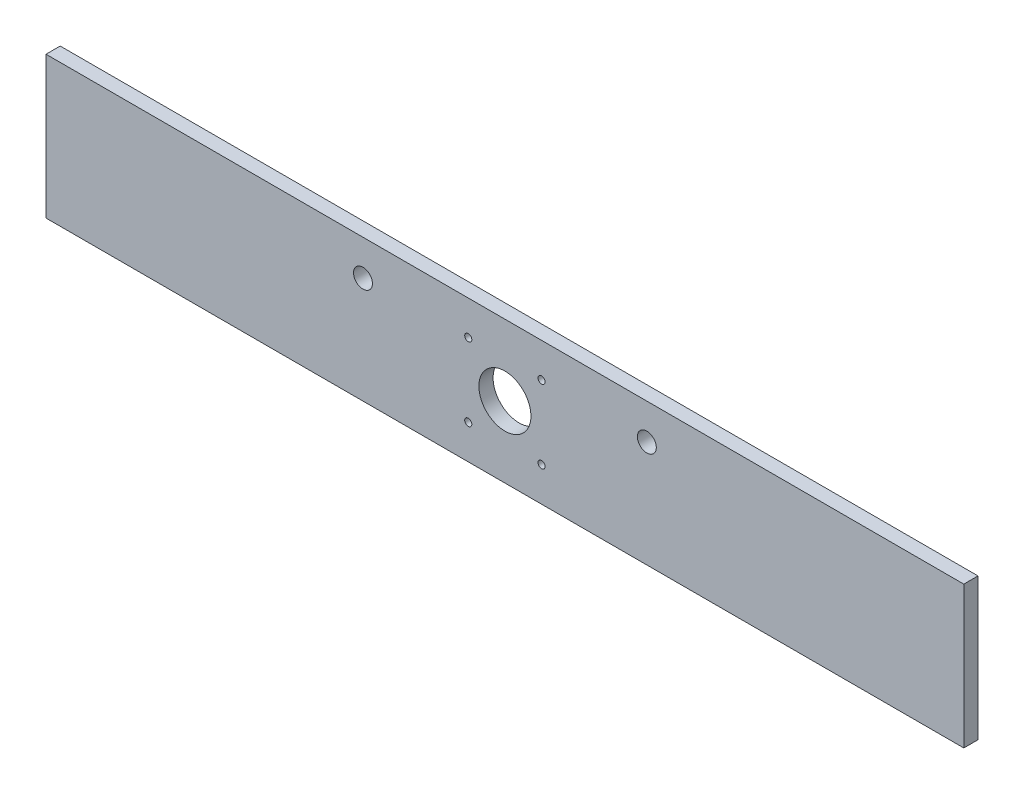
from build123d import *

# Parameters (mm, degrees)
SKETCH1_W           = 388
SKETCH1_H           = 60
SKETCH1_R           = 4
SKETCH1_R_2         = 11
BOSS_EXTRUDE1_DEPTH = 6
CUT_EXTRUDE1_REACH  = 198.398
SKETCH2_R           = 1.5


with BuildPart() as part:
    # Sketch1 → Boss-Extrude1 (new body)
    with BuildSketch(Plane.XY):
        Rectangle(SKETCH1_W, SKETCH1_H)
        with Locations((-60, 15)):
            Circle(SKETCH1_R, mode=Mode.SUBTRACT)
        Circle(SKETCH1_R_2, mode=Mode.SUBTRACT)
        with Locations((60, 15)):
            Circle(SKETCH1_R, mode=Mode.SUBTRACT)
    extrude(amount=BOSS_EXTRUDE1_DEPTH)

    # Sketch2 → Cut-Extrude1 (cut, up to next)
    with BuildSketch(Plane.XY.offset(6), mode=Mode.PRIVATE) as cut_extrude1_sk1:
        with Locations((15.495, 15.495)):
            Circle(SKETCH2_R)
    cut_extrude1_tool1 = extrude(cut_extrude1_sk1.sketch, amount=-CUT_EXTRUDE1_REACH, mode=Mode.PRIVATE) & part.part
    # Sketch2 → Cut-Extrude1 (cut, up to next)
    with BuildSketch(Plane.XY.offset(6), mode=Mode.PRIVATE) as cut_extrude1_sk2:
        with Locations((-15.495, 15.495)):
            Circle(SKETCH2_R)
    cut_extrude1_tool2 = extrude(cut_extrude1_sk2.sketch, amount=-CUT_EXTRUDE1_REACH, mode=Mode.PRIVATE) & part.part
    # Sketch2 → Cut-Extrude1 (cut, up to next)
    with BuildSketch(Plane.XY.offset(6), mode=Mode.PRIVATE) as cut_extrude1_sk3:
        with Locations((15.495, -15.495)):
            Circle(SKETCH2_R)
    cut_extrude1_tool3 = extrude(cut_extrude1_sk3.sketch, amount=-CUT_EXTRUDE1_REACH, mode=Mode.PRIVATE) & part.part
    # Sketch2 → Cut-Extrude1 (cut, up to next)
    with BuildSketch(Plane.XY.offset(6), mode=Mode.PRIVATE) as cut_extrude1_sk4:
        with Locations((-15.495, -15.495)):
            Circle(SKETCH2_R)
    cut_extrude1_tool4 = extrude(cut_extrude1_sk4.sketch, amount=-CUT_EXTRUDE1_REACH, mode=Mode.PRIVATE) & part.part
    add(cut_extrude1_tool1.solids().sort_by_distance((15.495, 15.495, 6))[0], mode=Mode.SUBTRACT)
    add(cut_extrude1_tool2.solids().sort_by_distance((-15.495, 15.495, 6))[0], mode=Mode.SUBTRACT)
    add(cut_extrude1_tool3.solids().sort_by_distance((15.495, -15.495, 6))[0], mode=Mode.SUBTRACT)
    add(cut_extrude1_tool4.solids().sort_by_distance((-15.495, -15.495, 6))[0], mode=Mode.SUBTRACT)


solid = part.part
